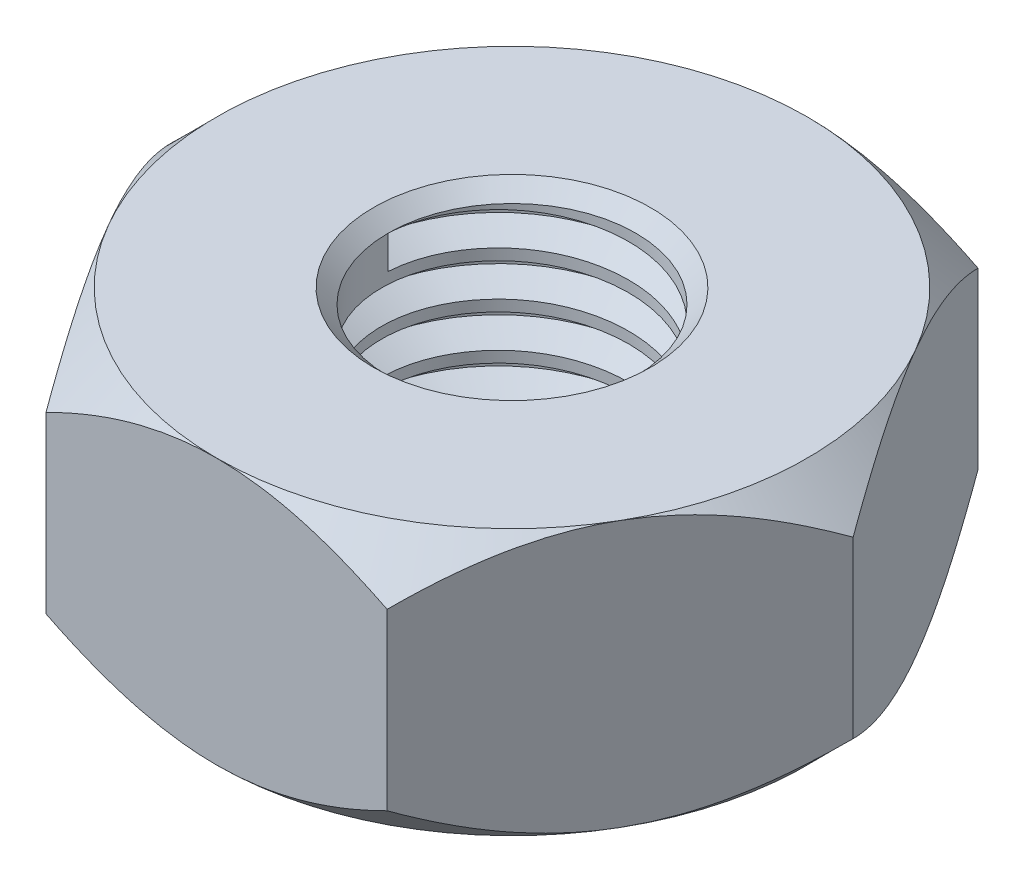
from build123d import *

# Parameters (mm, degrees)
BOSS_EXTRUDE1_DEPTH = 4.5
SKETCH2_R           = 4.19
CUT_EXTRUDE1_DEPTH  = 18.729448196
CHAMFER1_SIZE       = 0.5
THREAD2_PITCH       = 1.5
SKETCH11_OUTSIDE_W  = 51.464
SKETCH11_OUTSIDE_H  = 48.37
SKETCH11_OUTSIDE_R  = 10
CUT_EXTRUDE5_DEPTH  = 10
CUT_EXTRUDE5_TAPER  = 45


with BuildPart() as part:
    # Sketch1 → Boss-Extrude1 (new, symmetric)
    with BuildSketch(Plane(origin=(0, 0, 0), x_dir=(1, 0, 0), z_dir=(0, 1, 0))):
        Polygon((5.773502692, -10), (11.547005384, 0), (5.773502692, 10), (-5.773502692, 10), (-11.547005384, 0), (-5.773502692, -10), align=None)
    extrude(amount=BOSS_EXTRUDE1_DEPTH, both=True)

    # Sketch2 → Cut-Extrude1 (cut, through all)
    with BuildSketch(Plane(origin=(0, 4.5, 0), x_dir=(1, 0, 0), z_dir=(0, 1, 0))):
        with Locations(Location((0, 0, 0), (0, 0, 270))):
            Circle(SKETCH2_R)
    extrude(amount=-CUT_EXTRUDE1_DEPTH, mode=Mode.SUBTRACT)

    # Chamfer1
    chamfer1_edges = [part.edges().sort_by_distance(p)[0] for p in [
        (0, -4.5, -4.19),
        (0, 4.5, -4.19),
    ]]
    chamfer(chamfer1_edges, length=CHAMFER1_SIZE)

    # Thread2: the profile of Thread Profile2 profile screwed along a right-hand helix of 5.666733 turns, 8 arcs to a turn; built about Z, then put on its axis
    thread2_z = Axis((0, 0, 0), (0, 0, 1))
    thread2_corners = [(4.1897, 0, -0.000173205), (5.001898813, 0, 0.468749998), (5.001898813, 0, 0.656249998), (4.1897, 0, 1.125173201)]
    with BuildLine(mode=Mode.PRIVATE) as thread2_profile:
        Line(thread2_corners[0], thread2_corners[1])
        Line(thread2_corners[1], thread2_corners[2])
        Line(thread2_corners[2], thread2_corners[3])
        Line(thread2_corners[3], thread2_corners[0])
    thread2_cap = Face(thread2_profile.wire())
    thread2_turn_angles = [0, 22.5, 45, 67.5, 90, 112.5, 135, 157.5, 180, 202.5, 225, 247.5, 270, 292.5, 315, 337.5, 360]
    thread2_turn_weights = [1, 0.9238795325112867, 1, 0.9238795325112867, 1, 0.9238795325112867, 1, 0.9238795325112867, 1, 0.9238795325112867, 1, 0.9238795325112867, 1, 0.9238795325112867, 1, 0.9238795325112867, 1]
    thread2_turn_rails = [Edge.make_bspline([Vector(p[0], p[1], 0).rotate(thread2_z, thread2_turn_angles[k]) / thread2_turn_weights[k] + Vector(0, 0, p[2] + THREAD2_PITCH * thread2_turn_angles[k] / 360) for k in range(17)], [0, 0, 0, 1, 1, 2, 2, 3, 3, 4, 4, 5, 5, 6, 6, 7, 7, 8, 8, 8], 2, thread2_turn_weights) for p in thread2_corners]
    thread2_turn_sides = [Face.make_surface_from_curves(thread2_turn_rails[p[0]], thread2_turn_rails[p[1]]) for p in [(0, 1), (1, 2), (2, 3), (3, 0)]]
    thread2_last_angles = [1800, 1822.5, 1845, 1867.5, 1890, 1912.5, 1935, 1957.5, 1980, 2002.5, 2025, 2032.512, 2040.024]
    thread2_last_weights = [1, 0.9238795325112867, 1, 0.9238795325112867, 1, 0.9238795325112867, 1, 0.9238795325112867, 1, 0.9238795325112867, 1, 0.9914175022874218, 1]
    thread2_last_rails = [Edge.make_bspline([Vector(p[0], p[1], 0).rotate(thread2_z, thread2_last_angles[k]) / thread2_last_weights[k] + Vector(0, 0, p[2] + THREAD2_PITCH * thread2_last_angles[k] / 360) for k in range(13)], [0, 0, 0, 1, 1, 2, 2, 3, 3, 4, 4, 5, 5, 6, 6, 6], 2, thread2_last_weights) for p in thread2_corners]
    thread2_last_sides = [Face.make_surface_from_curves(thread2_last_rails[p[0]], thread2_last_rails[p[1]]) for p in [(0, 1), (1, 2), (2, 3), (3, 0)]]
    thread2 = Plane(origin=(0, 4.0001, 0), x_dir=(-1, 0, 0), z_dir=(0, -1, 0)) * Solid(Shell([*[p.moved(Location((0, 0, THREAD2_PITCH * i))) for i in range(5) for p in thread2_turn_sides], *thread2_last_sides, thread2_cap, thread2_cap.rotate(thread2_z, 2040.024).moved(Location((0, 0, THREAD2_PITCH * 2040.024 / 360)))]))
    add(thread2, mode=Mode.SUBTRACT)

    # Sketch11 outside → Cut-Extrude5 (cut)
    with BuildSketch(Plane(origin=(0, 4.5, 0), x_dir=(1, 0, 0), z_dir=(0, 1, 0))):
        Rectangle(SKETCH11_OUTSIDE_W, SKETCH11_OUTSIDE_H)
        Circle(SKETCH11_OUTSIDE_R, mode=Mode.SUBTRACT)
    cut_extrude5 = extrude(amount=-CUT_EXTRUDE5_DEPTH, taper=CUT_EXTRUDE5_TAPER, mode=Mode.SUBTRACT)

    # Mirror4: Cut-Extrude5 across plane
    add(cut_extrude5.mirror(Plane.ZX), mode=Mode.SUBTRACT)


solid = part.part
